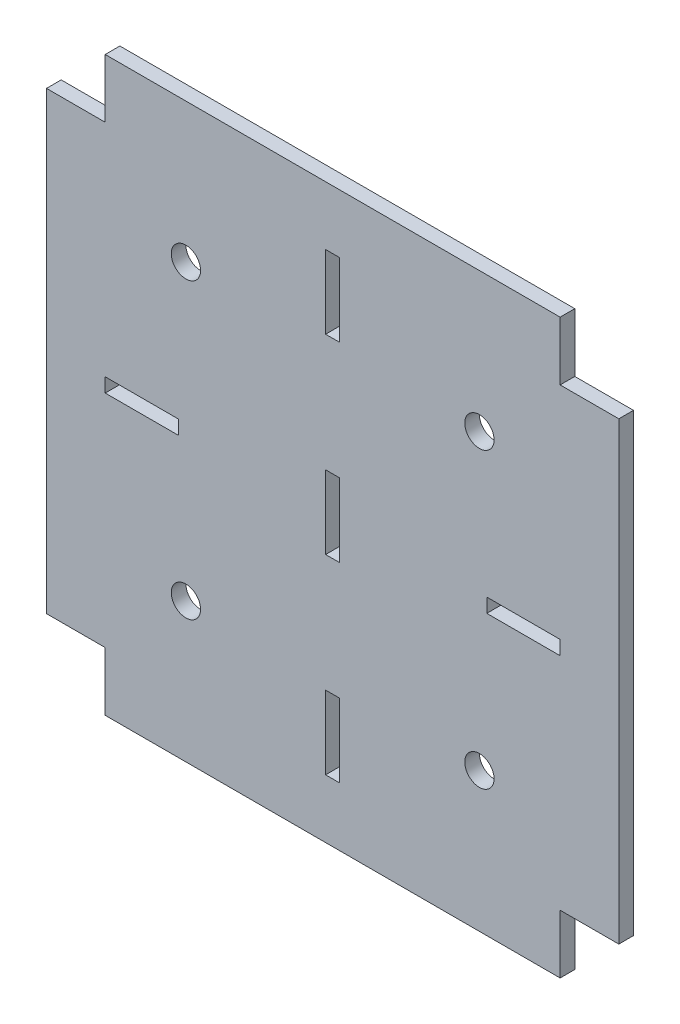
from build123d import *

# Parameters (mm, degrees)
SKETCH_1_R      = 2
SKETCH_1_W      = 1.923125
SKETCH_1_H      = 10
SKETCH_1_W_2    = 10
SKETCH_1_H_2    = 1.923125
EXTRUDE_1_DEPTH = 2


with BuildPart() as part:
    # 草圖1 → 填料-伸長1 (new body)
    with BuildSketch(Plane.XY):
        Polygon((-31, 39), (31, 39), (31, 31), (39, 31), (39, -31), (31, -31), (31, -39), (-31, -39), (-31, -31), (-39, -31), (-39, 31), (-31, 31), align=None)
        with Locations((-20, 20)):
            Circle(SKETCH_1_R, mode=Mode.SUBTRACT)
        with Locations((20, 20)):
            Circle(SKETCH_1_R, mode=Mode.SUBTRACT)
        with Locations((20, -20)):
            Circle(SKETCH_1_R, mode=Mode.SUBTRACT)
        with Locations((-20, -20)):
            Circle(SKETCH_1_R, mode=Mode.SUBTRACT)
        with Locations((0, -26)):
            Rectangle(SKETCH_1_W, SKETCH_1_H, mode=Mode.SUBTRACT)
        with Locations((0, 26)):
            Rectangle(SKETCH_1_W, SKETCH_1_H, mode=Mode.SUBTRACT)
        with Locations((-26, 0)):
            Rectangle(SKETCH_1_W_2, SKETCH_1_H_2, mode=Mode.SUBTRACT)
        with Locations((26, 0)):
            Rectangle(SKETCH_1_W_2, SKETCH_1_H_2, mode=Mode.SUBTRACT)
        Rectangle(SKETCH_1_W, SKETCH_1_H, mode=Mode.SUBTRACT)
    extrude(amount=EXTRUDE_1_DEPTH)


solid = part.part
